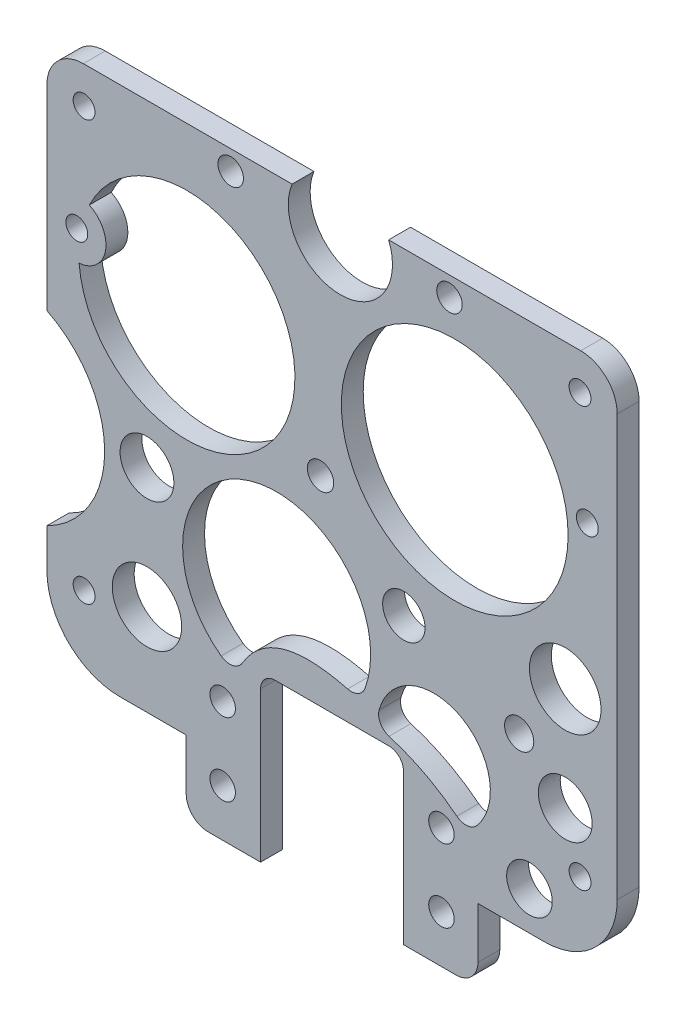
from build123d import *
from OCP.BRepFilletAPI import BRepFilletAPI_MakeChamfer

# Parameters (mm, degrees)
SKETCH_1_W           = 176
SKETCH_1_H           = 80
EXTRUDE_1_DEPTH      = 3
SKETCH_2_R           = 1.75
CUT_EXTRUDE_1_DEPTH  = 3
SKETCH_3_R           = 2
CUT_EXTRUDE_2_DEPTH  = 3
FILLET_2_SIZE        = 40
FILLET_2_SIZE_2      = 20
FILLET_3_R           = 10
SKETCH_7_W           = 46
SKETCH_7_H           = 25
EXTRUDE_2_DEPTH      = 3
SKETCH_8_R           = 1.75
CUT_EXTRUDE_5_DEPTH  = 10
SKETCH_9_R           = 1.5
CUT_EXTRUDE_6_DEPTH  = 10
SKETCH_12_R          = 1.5
CUT_EXTRUDE_9_DEPTH  = 4
SKETCH_10_R          = 14.822822372
SKETCH_10_R_2        = 15.54793228
SKETCH_10_R_3        = 12.890133266
SKETCH_10_R_4        = 7.757021253
SKETCH_10_R_5        = 6.934601812
SKETCH_10_R_6        = 7.029600784
SKETCH_10_R_7        = 7.14393757
SKETCH_10_R_8        = 6.581917706
SKETCH_10_R_9        = 14.255365134
SKETCH_10_R_10       = 5.884344846
SKETCH_10_W          = 50
SKETCH_10_H          = 42
CUT_EXTRUDE_10_DEPTH = 10
FILLET_4_R           = 10
SKETCH_13_W          = 107.593343732
SKETCH_13_H          = 96.683988594
CUT_EXTRUDE_11_DEPTH = 10
FILLET_5_R           = 10
SKETCH_15_W          = 40
SKETCH_15_H          = 15
EXTRUDE_4_DEPTH      = 3
FILLET_8_R           = 3
SKETCH_16_R          = 1.75
CUT_EXTRUDE_12_DEPTH = 10
CUT_EXTRUDE_13_DEPTH = 10
EXTRUDE_START        = -3
EXTRUDE_5_DEPTH      = 3
FILLET_9_R           = 2
FILLET_10_R          = 2
SKETCH_20_W          = 78.200000008
SKETCH_20_H          = 3
EXTRUDE_6_DEPTH      = 10
SKETCH_21_R          = 1.5
CUT_EXTRUDE_14_DEPTH = 8
CHAMFER_1_SIZE       = 8
CHAMFER_1_SIZE2      = 13.856406461
CUT_EXTRUDE_START    = -8
SKETCH_23_R          = 1.5
CUT_EXTRUDE_15_DEPTH = 8
SKETCH_24_R          = 4.905902743
SKETCH_24_R_2        = 2.904809147
SKETCH_24_R_3        = 3.688554183
SKETCH_24_R_4        = 4.759424753
SKETCH_24_R_5        = 3.130126802
SKETCH_24_R_6        = 1.813066271
CUT_EXTRUDE_16_DEPTH = 8
SKETCH_25_W          = 83.904455519
SKETCH_25_H          = 24.388420685
CUT_EXTRUDE_17_DEPTH = 10
FILLET_11_R          = 5
SKETCH_26_R          = 1.5
CUT_EXTRUDE_18_DEPTH = 10
EXTRUDE_7_DEPTH      = 3


with BuildPart() as part:
    # 草图1 → 凸台-拉伸1 (new body)
    with BuildSketch(Plane.XY):
        Rectangle(SKETCH_1_W, SKETCH_1_H)
    extrude(amount=EXTRUDE_1_DEPTH)

    # 草图2 → 切除-拉伸1 (cut)
    with BuildSketch(Plane(origin=(0, 0, 0), x_dir=(-1, 0, 0), z_dir=(0, 0, -1))):
        with Locations((65, 30)):
            Circle(SKETCH_2_R)
        with Locations((35, 30)):
            Circle(SKETCH_2_R)
        with Locations((-35, 30)):
            Circle(SKETCH_2_R)
        with Locations((-65, 30)):
            Circle(SKETCH_2_R)
        Polygon((77.028594491, 36.791653669), (56.939180126, 54.369891239), (101.028594491, 54.369891239), (101.028594491, 15.791653669), align=None)
        Polygon((-23, 40.742269916), (-23, 20.742269916), (-23, 17.742269916), (-23, 15), (23, 15), (23, 17.742269916), (23, 20), (23, 40), align=None)
    extrude(amount=-CUT_EXTRUDE_1_DEPTH, mode=Mode.SUBTRACT)

    # 草图3 → 切除-拉伸2 (cut)
    with BuildSketch(Plane(origin=(0, 0, 0), x_dir=(-1, 0, 0), z_dir=(0, 0, -1))):
        with Locations(Location((-74.557808033, -16.995048107, 0), (0, 0, 180))):
            Circle(SKETCH_3_R)
    extrude(amount=-CUT_EXTRUDE_2_DEPTH, mode=Mode.SUBTRACT)

    # 圆角2
    # an asymmetric fillet: 40, 20 mm, written as the material it takes off along each edge
    with BuildSketch(Plane(origin=(-88, -40, -100), x_dir=(1, 0, 0), z_dir=(0, 0, 1))) as fillet_2_piece_1:
        with BuildLine():
            Bezier((FILLET_2_SIZE, 0), (0, 0), (0, FILLET_2_SIZE_2), weights=[1, 0.707106781, 1])
            Line((0, FILLET_2_SIZE_2), (0, 0))
            Line((0, 0), (FILLET_2_SIZE, 0))
        make_face()
    extrude(amount=203, mode=Mode.SUBTRACT)

    # 圆角3
    fillet_3_edges = [part.edges().sort_by_distance(p)[0] for p in [
        (88, -40, 1.5),
    ]]
    fillet(fillet_3_edges, radius=FILLET_3_R)

    # 草图7 → 凸台-拉伸2 (add)
    with BuildSketch(Plane.XY.offset(3)):
        with Locations((0, 27.5)):
            Rectangle(SKETCH_7_W, SKETCH_7_H)
    extrude(amount=-EXTRUDE_2_DEPTH)

    # 草图8 → 切除-拉伸5 (cut)
    with BuildSketch(Plane.XY.offset(3)):
        with Locations((-15.600000004, -14.741858523)):
            Circle(SKETCH_8_R)
        with Locations((-15.600000004, -0.741858523)):
            Circle(SKETCH_8_R)
        with Locations((-76.600000004, -14.741858523)):
            Circle(SKETCH_8_R)
        with Locations((-76.600000004, -0.741858523)):
            Circle(SKETCH_8_R)
    extrude(amount=-CUT_EXTRUDE_5_DEPTH, mode=Mode.SUBTRACT)

    # 草图9 → 切除-拉伸6 (cut)
    with BuildSketch(Plane.XY.offset(3)):
        with Locations((14.899999996, 27.680531328)):
            Circle(SKETCH_9_R)
        with Locations((14.899999996, -29.819468672)):
            Circle(SKETCH_9_R)
        with Locations((82.899999996, 27.680531328)):
            Circle(SKETCH_9_R)
    extrude(amount=-CUT_EXTRUDE_6_DEPTH, mode=Mode.SUBTRACT)

    # 草图12 → 切除-拉伸9 (cut)
    with BuildSketch(Plane(origin=(0, 0, 0), x_dir=(-1, 0, 0), z_dir=(0, 0, -1))):
        with Locations((6.36299939, -26)):
            Circle(SKETCH_12_R)
        with Locations((6.36299939, -36)):
            Circle(SKETCH_12_R)
        with Locations((36.36299939, -26)):
            Circle(SKETCH_12_R)
        with Locations((36.36299939, -36)):
            Circle(SKETCH_12_R)
    extrude(amount=-CUT_EXTRUDE_9_DEPTH, mode=Mode.SUBTRACT)

    # 草图10 → 切除-拉伸10 (cut)
    with BuildSketch(Plane.XY.offset(3)):
        with Locations((28.987847861, 9.896794242)):
            Circle(SKETCH_10_R)
        with Locations((65.718775612, 9.896794242)):
            Circle(SKETCH_10_R_2)
        with Locations((41.299890682, -17.805302107)):
            Circle(SKETCH_10_R_3)
        with Locations((62.84596562, -25.808129941)):
            Circle(SKETCH_10_R_4)
        with Locations((-21.047385867, 29.993904331)):
            Circle(SKETCH_10_R_5)
        with Locations((1.160652102, 29.993904331)):
            Circle(SKETCH_10_R_6)
        with Locations((50.038655847, 29.993904331)):
            Circle(SKETCH_10_R_7)
        with Locations((-49.899983992, 31.034790405)):
            Circle(SKETCH_10_R_8)
        with Locations((3.463764683, -11.926168688)):
            Circle(SKETCH_10_R_9)
        with Locations((-5.845999613, 14.761822293)):
            Circle(SKETCH_10_R_10)
        with Locations((-46.100000004, -7.741858523)):
            Rectangle(SKETCH_10_W, SKETCH_10_H)
    extrude(amount=-CUT_EXTRUDE_10_DEPTH, mode=Mode.SUBTRACT)

    # 圆角4
    fillet_4_edges = [part.edges().sort_by_distance(p)[0] for p in [
        (-21.100000004, 13.258141477, 1.5),
        (-21.100000004, -28.741858523, 1.5),
        (-71.100000004, -28.741858523, 1.5),
        (-71.100000004, 13.258141477, 1.5),
    ]]
    fillet(fillet_4_edges, radius=FILLET_4_R)

    # 草图13 → 切除-拉伸11 (cut)
    with BuildSketch(Plane(origin=(0, 0, 0), x_dir=(-1, 0, 0), z_dir=(0, 0, -1))):
        with Locations((43.996671874, -8.341994297)):
            Rectangle(SKETCH_13_W, SKETCH_13_H)
    extrude(amount=-CUT_EXTRUDE_11_DEPTH, mode=Mode.SUBTRACT)

    # 圆角5
    fillet_5_edges = [part.edges().sort_by_distance(p)[0] for p in [
        (9.799999992, -40, 1.5),
    ]]
    fillet(fillet_5_edges, radius=FILLET_5_R)

    # 草图15 → 凸台-拉伸4 (add)
    with BuildSketch(Plane(origin=(0, 0, 0), x_dir=(-1, 0, 0), z_dir=(0, 0, -1))):
        with Locations((-48.899999996, -42.5)):
            Rectangle(SKETCH_15_W, SKETCH_15_H)
    extrude(amount=-EXTRUDE_4_DEPTH)

    # 圆角8
    fillet_8_edges = [part.edges().sort_by_distance(p)[0] for p in [
        (68.899999996, -50, 1.5),
        (28.899999996, -50, 1.5),
    ]]
    fillet(fillet_8_edges, radius=FILLET_8_R)

    # 草图16 → 切除-拉伸12 (cut)
    with BuildSketch(Plane(origin=(0, 0, 0), x_dir=(-1, 0, 0), z_dir=(0, 0, -1))):
        with Locations((-63.899999996, -33.5)):
            Circle(SKETCH_16_R)
        with Locations((-33.899999996, -43.5)):
            Circle(SKETCH_16_R)
        with Locations((-63.899999996, -43.5)):
            Circle(SKETCH_16_R)
        with Locations((-33.899999996, -33.5)):
            Circle(SKETCH_16_R)
    extrude(amount=-CUT_EXTRUDE_12_DEPTH, mode=Mode.SUBTRACT)

    # 草图17 → 切除-拉伸13 (cut)
    with BuildSketch(Plane(origin=(0, 0, 0), x_dir=(-1, 0, 0), z_dir=(0, 0, -1))):
        Polygon((-39.099999996, -40.75), (-39.099999996, -55.483029853), (-58.699999996, -55.483029853), (-58.699999996, -40.75), (-58.699999996, -27.4), (-54.699999996, -27.4), (-43.099999996, -27.4), (-39.099999996, -27.4), align=None)
    extrude(amount=-CUT_EXTRUDE_13_DEPTH, mode=Mode.SUBTRACT)

    # 草图18 → 凸台-拉伸5 (add)
    with BuildSketch(Plane(origin=(0, 0, 0), x_dir=(-1, 0, 0), z_dir=(0, 0, -1)).offset(EXTRUDE_START)):
        with BuildLine():
            Line((-58.699999996, -27.4), (-55.254040408, -27.4))
            ThreePointArc((-55.254040408, -27.4), (-55.130328772, -26.608334131), (-55.088944367, -25.808129941))
            add(Edge.make_bspline(
                [(-67.298229637, -32.160194474), (-61.975792576, -27.448828616), (-55.088944367, -25.808129941)],
                knots=[0, 0, 0, 1, 1, 1], degree=2))
            ThreePointArc((-67.298229637, -32.160194474), (-66.474383914, -32.664219161), (-65.594291299, -33.061962354))
            ThreePointArc((-65.594291299, -33.061962354), (-63.662413835, -31.766202775), (-62.150328303, -33.533896403))
            ThreePointArc((-62.150328303, -33.533896403), (-60.35552106, -33.154493981), (-58.699999996, -32.364222356))
            Line((-58.699999996, -32.364222356), (-58.699999996, -27.4))
        make_face()
        with BuildLine():
            Line((-49.907870001, -27.4), (-39.099999996, -27.4))
            Line((-39.099999996, -27.4), (-39.099999996, -30.506326341))
            ThreePointArc((-39.099999996, -30.506326341), (-37.365509299, -30.080324663), (-35.706552784, -29.418661086))
            add(Edge.make_bspline(
                [(-52.644932329, -23.924580303), (-39.613903701, -19.826081503), (-35.706552784, -29.418661086)],
                knots=[0, 0, 0, 1, 1, 1], degree=2))
            ThreePointArc((-52.644932329, -23.924580303), (-51.426607669, -25.780585091), (-49.907870001, -27.4))
        make_face()
    extrude(amount=EXTRUDE_5_DEPTH)

    # 圆角9
    fillet_9_edges = [part.edges().sort_by_distance(p)[0] for p in [
        (58.699999996, -27.4, 1.5),
        (39.099999996, -27.4, 1.5),
    ]]
    fillet(fillet_9_edges, radius=FILLET_9_R)

    # 圆角10
    fillet_10_edges = [part.edges().sort_by_distance(p)[0] for p in [
        (35.706552784, -29.418661086, 1.5),
        (52.644932329, -23.924580303, 1.5),
        (55.088944367, -25.808129941, 1.5),
        (67.298229637, -32.160194474, 1.5),
    ]]
    fillet(fillet_10_edges, radius=FILLET_10_R)

    # 草图20 → 凸台-拉伸6 (add)
    with BuildSketch(Plane(origin=(0, 40, 0), x_dir=(1, 0, 0), z_dir=(0, 1, 0))):
        with Locations((48.899999996, -1.5)):
            Rectangle(SKETCH_20_W, SKETCH_20_H)
    extrude(amount=EXTRUDE_6_DEPTH)

    # 草图21 → 切除-拉伸14 (cut)
    with BuildSketch(Plane(origin=(0, 0, 0), x_dir=(-1, 0, 0), z_dir=(0, 0, -1))):
        with Locations((-13.899999996, 40)):
            Circle(SKETCH_21_R)
        with Locations((-83.899999996, 40)):
            Circle(SKETCH_21_R)
    extrude(amount=-CUT_EXTRUDE_14_DEPTH, mode=Mode.SUBTRACT)

    # 倒角1: one chamfer whose edges measure the first distance from different faces: ONE call of the kernel's chamfer builder (chamfer() names one face for all edges)
    chamfer_1_edges_1 = [part.edges().sort_by_distance(p)[0] for p in [
        (9.799999992, 50, 1.5),
    ]]
    chamfer_1_side_1 = [part.faces().sort_by_distance(p)[0] for p in [
        (9.799999992, 25.421811059, 1.5),
    ]]
    chamfer_1_edges_2 = [part.edges().sort_by_distance(p)[0] for p in [
        (88, 50, 1.5),
    ]]
    chamfer_1_side_2 = [part.faces().sort_by_distance(p)[0] for p in [
        (88, 10, 1.5),
    ]]
    chamfer_1 = BRepFilletAPI_MakeChamfer(part.part.solid().wrapped)
    for e in chamfer_1_edges_1:
        chamfer_1.Add(CHAMFER_1_SIZE, CHAMFER_1_SIZE2, e.wrapped, chamfer_1_side_1[0].wrapped)  # the first distance lies on this face
    for e in chamfer_1_edges_2:
        chamfer_1.Add(CHAMFER_1_SIZE, CHAMFER_1_SIZE2, e.wrapped, chamfer_1_side_2[0].wrapped)  # the first distance lies on this face
    add(Compound.cast(chamfer_1.Shape()), mode=Mode.REPLACE)

    # 草图23 → 切除-拉伸15 (cut)
    with BuildSketch(Plane(origin=(0, 0, 0), x_dir=(-1, 0, 0), z_dir=(0, 0, -1)).offset(CUT_EXTRUDE_START)):
        with Locations(Location((-14.899999996, -29.819468672, 0), (0, 0, 180))):
            Circle(SKETCH_23_R)
        with Locations((-82.899999996, -29.819468672)):
            Circle(SKETCH_23_R)
    extrude(amount=CUT_EXTRUDE_15_DEPTH, mode=Mode.SUBTRACT)

    # 草图24 → 切除-拉伸16 (cut)
    with BuildSketch(Plane(origin=(0, 0, 0), x_dir=(-1, 0, 0), z_dir=(0, 0, -1))):
        with Locations((-80.872422916, -8.538682567)):
            Circle(SKETCH_24_R)
        with Locations((-58.741097816, -10.918394943)):
            Circle(SKETCH_24_R_2)
        with Locations((-23.521354645, -10.918394943)):
            Circle(SKETCH_24_R_3)
        with Locations((-23.521354645, -27.457395959)):
            Circle(SKETCH_24_R_4)
        with Locations((-75.966520173, -34.715518707)):
            Circle(SKETCH_24_R_5)
        with Locations((-80.872422916, -22.697971206)):
            Circle(SKETCH_24_R_3)
        with Locations((-47.318478409, 0)):
            Circle(SKETCH_24_R_6)
    extrude(amount=-CUT_EXTRUDE_16_DEPTH, mode=Mode.SUBTRACT)

    # 草图25 → 切除-拉伸17 (cut)
    with BuildSketch(Plane(origin=(0, 0, 0), x_dir=(-1, 0, 0), z_dir=(0, 0, -1))):
        with Locations((-46.047772241, 44.874741671)):
            Rectangle(SKETCH_25_W, SKETCH_25_H)
    extrude(amount=-CUT_EXTRUDE_17_DEPTH, mode=Mode.SUBTRACT)

    # 圆角11
    fillet_11_edges = [part.edges().sort_by_distance(p)[0] for p in [
        (9.799999992, 32.680531328, 1.5),
        (88, 32.680531328, 1.5),
    ]]
    fillet(fillet_11_edges, radius=FILLET_11_R)

    # 草图26 → 切除-拉伸18 (cut)
    with BuildSketch(Plane(origin=(0, 0, 0), x_dir=(-1, 0, 0), z_dir=(0, 0, -1))):
        with Locations((-83.899999996, 12.680531328)):
            Circle(SKETCH_26_R)
        with Locations((-13.899999996, 12.680531328)):
            Circle(SKETCH_26_R)
    extrude(amount=-CUT_EXTRUDE_18_DEPTH, mode=Mode.SUBTRACT)

    # 草图27 → 凸台-拉伸7 (add)
    with BuildSketch(Plane(origin=(0, 0, 0), x_dir=(-1, 0, 0), z_dir=(0, 0, -1)).offset(EXTRUDE_START)):
        with BuildLine():
            ThreePointArc((-14.725176393, 13.933162125), (-15.375103135, 12.408371948), (-14.223837257, 11.215905291))
            ThreePointArc((-14.223837257, 11.215905291), (-14.165138203, 9.954599731), (-14.213997961, 8.692874713))
            ThreePointArc((-14.213997961, 8.692874713), (-17.833608368, 11.954772982), (-15.616343872, 16.29358595))
            ThreePointArc((-15.616343872, 16.29358595), (-15.120446754, 15.132369629), (-14.725176393, 13.933162125))
        make_face()
    extrude(amount=EXTRUDE_7_DEPTH)


solid = part.part
